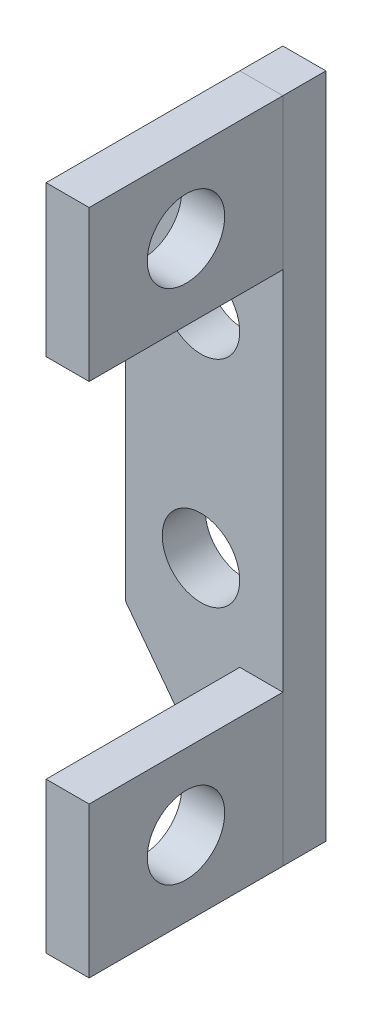
from build123d import *

# Parameters (mm, degrees)
BOSS_EXTRUDE1_DEPTH           = 2
M3_CLEARANCE_HOLE1_D          = 3.6
SKETCH6_W                     = 2
SKETCH6_H                     = 7
BOSS_EXTRUDE2_DEPTH           = 9
BOSS_EXTRUDE2_2_DEPTH         = 9
SKETCH8_W                     = 1.8
SKETCH8_H                     = 2
M3_CLEARANCE_HOLE2_AT_2_COUNT = 2
M3_CLEARANCE_HOLE2_AT_2_PITCH = 24


with BuildPart() as part:
    # Sketch2 → Boss-Extrude1 (new body)
    with BuildSketch(Plane.XY):
        Polygon((-10, 213.920635549), (-10, 196.920635549), (-4.695589791, 189.920635549), (-2.695589791, 189.920635549), (-2.695589791, 220.920635549), (-4.695589791, 220.920635549), align=None)
    extrude(amount=BOSS_EXTRUDE1_DEPTH)

    # M3 Clearance Hole1 (through all)
    with Locations(Plane.XY.offset(2)):
        with Locations((-6.5, 200.420635549), (-6.5, 210.420635549)):
            Hole(M3_CLEARANCE_HOLE1_D / 2)


with BuildPart() as body_2:
    # Sketch6 → Boss-Extrude2 (new body)
    with BuildSketch(Plane.XY.offset(2)):
        with Locations((-3.695589791, 217.420635549)):
            Rectangle(SKETCH6_W, SKETCH6_H)
    extrude(amount=BOSS_EXTRUDE2_DEPTH)


with BuildPart() as body_3:
    # Sketch6 → Boss-Extrude2 2 (new body)
    with BuildSketch(Plane.XY.offset(2)):
        with Locations((-3.695589791, 193.420635549)):
            Rectangle(SKETCH6_W, SKETCH6_H)
    extrude(amount=BOSS_EXTRUDE2_2_DEPTH)

    # Sketch8 → M3 Clearance Hole2 (revolve, cut)
    with BuildSketch(Plane(origin=(-4.695589791, 193.420635549, 6.5), x_dir=(0, 0, 1), z_dir=(0, 1, 0))):
        with Locations((0.9, 1)):
            Rectangle(SKETCH8_W, SKETCH8_H)
    m3_clearance_hole2 = revolve(axis=Axis((-11.045589791, 193.420635549, 6.5), (1, 0, 0)), mode=Mode.SUBTRACT)


with BuildPart() as body_2_1:
    add(body_2.part)

    # M3 Clearance Hole2 at 2: M3 Clearance Hole2 ×2
    with Locations(*[(0, i * M3_CLEARANCE_HOLE2_AT_2_PITCH, 0) for i in range(1, M3_CLEARANCE_HOLE2_AT_2_COUNT)]):
        add(m3_clearance_hole2, mode=Mode.SUBTRACT)


solid = Compound([part.part, body_3.part, body_2_1.part])
